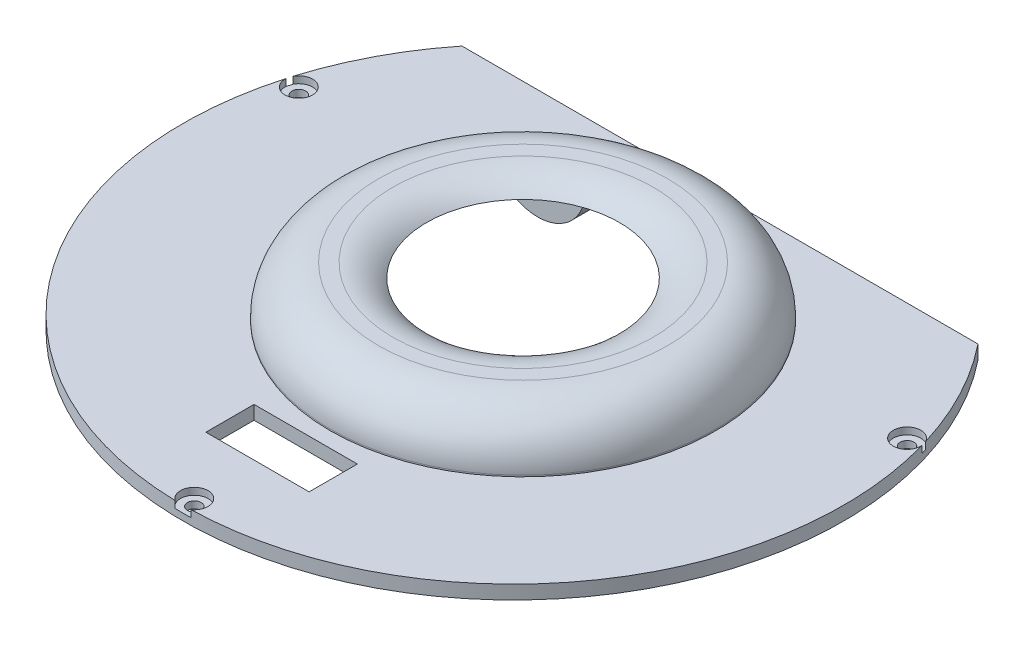
from build123d import *
from build123d.topology import SkipClean

# Parameters (mm, degrees)
BOSS_EXTRUDE1_DEPTH = 2
SKETCH4_R           = 1
CUT_EXTRUDE3_DEPTH  = 2
SKETCH5_R           = 2
CUT_EXTRUDE4_DEPTH  = 1
SKETCH2_R           = 5
CUT_EXTRUDE1_DEPTH  = 10
SKETCH3_R           = 24
CUT_EXTRUDE2_DEPTH  = 10
BOSS_EXTRUDE2_START = 7.2
SKETCH6_R           = 28
SKETCH6_R_2         = 24
BOSS_EXTRUDE2_DEPTH = 7.2
SKETCH7_R           = 28
SKETCH7_R_2         = 14
BOSS_EXTRUDE3_DEPTH = 2
SKETCH9_W           = 14
SKETCH9_H           = 12
BOSS_EXTRUDE4_DEPTH = 4
FILLET1_R           = 7
SKETCH10_R          = 3.25
CUT_EXTRUDE6_DEPTH  = 3
BOSS_EXTRUDE5_DEPTH = 2
FILLET2_R           = 7
FILLET3_R           = 7
FILLET4_R           = 4
FILLET5_R           = 4
SKETCH12_W          = 15
SKETCH12_H          = 7
CUT_EXTRUDE7_DEPTH  = 10


# Some blends are built 0.0001 mm under size
with BuildPart() as part:
    # Sketch1 → Boss-Extrude1 (new body)
    with BuildSketch(Plane(origin=(0, 0, 0), x_dir=(1, 0, 0), z_dir=(0, 1, 0))):
        with BuildLine():
            Line((-37.46998799, 30), (37.46998799, 30))
            ThreePointArc((37.46998799, 30), (0, -48), (-37.46998799, 30))
        make_face()
    extrude(amount=BOSS_EXTRUDE1_DEPTH)

    # Sketch4 → Cut-Extrude3 (cut)
    with BuildSketch(Plane(origin=(0, 2, 0), x_dir=(1, 0, 0), z_dir=(0, 1, 0))):
        with Locations(Location((-44.167045026, 13, 0), (0, 0, 270))):
            Circle(SKETCH4_R)
        with Locations(Location((0, -46.347801012, 0), (0, 0, 270))):
            Circle(SKETCH4_R)
        with Locations(Location((44.167045026, 13, 0), (0, 0, 270))):
            Circle(SKETCH4_R)
    extrude(amount=-CUT_EXTRUDE3_DEPTH, mode=Mode.SUBTRACT)

    # Sketch5 → Cut-Extrude4 (cut)
    with BuildSketch(Plane(origin=(0, 2, 0), x_dir=(1, 0, 0), z_dir=(0, 1, 0))):
        with Locations((-44.167045026, 13)):
            Circle(SKETCH5_R)
        with Locations((0, -46.347801012)):
            Circle(SKETCH5_R)
        with Locations((44.167045026, 13)):
            Circle(SKETCH5_R)
    extrude(amount=-CUT_EXTRUDE4_DEPTH, mode=Mode.SUBTRACT)

    # Sketch2 → Cut-Extrude1 (cut)
    with BuildSketch(Plane(origin=(0, 2, 0), x_dir=(1, 0, 0), z_dir=(0, 1, 0))):
        with Locations(Location((1.35, 0.05, 0), (0, 0, 270))):
            Circle(SKETCH2_R)
    extrude(amount=-CUT_EXTRUDE1_DEPTH, mode=Mode.SUBTRACT)

    # Sketch3 → Cut-Extrude2 (cut)
    with BuildSketch(Plane(origin=(0, 2, 0), x_dir=(1, 0, 0), z_dir=(0, 1, 0))):
        with Locations(Location((1.35, 0.05, 0), (0, 0, 270))):
            Circle(SKETCH3_R)
    extrude(amount=-CUT_EXTRUDE2_DEPTH, mode=Mode.SUBTRACT)

    # Sketch6 → Boss-Extrude2 (add)
    with BuildSketch(Plane(origin=(0, 2, 0), x_dir=(1, 0, 0), z_dir=(0, 1, 0)).offset(BOSS_EXTRUDE2_START)):
        with Locations(Location((1.35, 0.05, 0), (0, 0, 270))):
            Circle(SKETCH6_R)
        with Locations(Location((1.35, 0.05, 0), (0, 0, 270))):
            Circle(SKETCH6_R_2, mode=Mode.SUBTRACT)
    extrude(amount=-BOSS_EXTRUDE2_DEPTH)

    # Sketch7 → Boss-Extrude3 (add)
    with BuildSketch(Plane(origin=(0, 9.2, 0), x_dir=(1, 0, 0), z_dir=(0, 1, 0))):
        with Locations(Location((1.35, 0.05, 0), (0, 0, 270))):
            Circle(SKETCH7_R)
        with Locations(Location((1.35, 0.05, 0), (0, 0, 270))):
            Circle(SKETCH7_R_2, mode=Mode.SUBTRACT)
    extrude(amount=-BOSS_EXTRUDE3_DEPTH)

    # Sketch9 → Boss-Extrude4 (add)
    with BuildSketch(Plane(origin=(0, 0, -30), x_dir=(-1, 0, 0), z_dir=(0, 0, -1))):
        with Locations((-22.46998799, -4)):
            Rectangle(SKETCH9_W, SKETCH9_H)
        with Locations((22.46998799, -4)):
            Rectangle(SKETCH9_W, SKETCH9_H)
    extrude(amount=-BOSS_EXTRUDE4_DEPTH)

    # Fillet1
    fillet1_edges = [part.edges().sort_by_distance(p)[0] for p in [
        (-29.46998799, -10, -28),
        (-15.46998799, -10, -28),
        (15.46998799, -10, -28),
        (29.46998799, -10, -28),
    ]]
    fillet(fillet1_edges, radius=FILLET1_R - 0.0001)  # a hair under: the kernel refuses the full size

    # Sketch10 → Cut-Extrude6 (cut)
    with BuildSketch(Plane(origin=(0, 0, -30), x_dir=(-1, 0, 0), z_dir=(0, 0, -1))):
        with Locations((-22.46998799, -3)):
            Circle(SKETCH10_R)
        with Locations((22.46998799, -3)):
            Circle(SKETCH10_R)
    extrude(amount=-CUT_EXTRUDE6_DEPTH, mode=Mode.SUBTRACT)

    # Sketch11 → Boss-Extrude5 (add)
    with BuildSketch(Plane(origin=(0, 9.2, 0), x_dir=(1, 0, 0), z_dir=(0, 1, 0))):
        with BuildLine():
            Line((-8.65, 15.016629547), (-8.65, 9.847958971))
            ThreePointArc((-8.65, 9.847958971), (1.35, 14.05), (11.35, 9.847958971))
            Line((11.35, 9.847958971), (11.35, 15.016629547))
            ThreePointArc((11.35, 15.016629547), (1.35, 18.05), (-8.65, 15.016629547))
        make_face()
    extrude(amount=-BOSS_EXTRUDE5_DEPTH)

    # Fillet2
    fillet2_edges = [part.edges().sort_by_distance(p)[0] for p in [
        (1.35, 9.2, -28.05),
    ]]
    fillet(fillet2_edges, radius=FILLET2_R)

    # Fillet3
    # the kernel refuses this fillet: 7 mm, written as the material it takes off along each edge
    with BuildSketch(Plane(origin=(1.35, 9.2, -0.05), x_dir=(0, 0, 1), z_dir=(-1, 0, 0))) as fillet3_piece_1:
        with BuildLine():
            CenterArc((18.898979486, -7), FILLET3_R, 90, 44.415308597)
            Line((14, -2), (13.90202041, -1.9))
            ThreePointArc((13.90202041, -1.9), (13.86, -1), (13.86, 0))
            Line((13.86, 0), (14, 0.14))
            Line((14, 0.14), (18.898979486, 0.14))
            Line((18.898979486, 0.14), (18.898979486, 0))
        make_face()
    revolve(axis=Axis((1.35, 9.2, -0.05), (0, 1, 0)), revolution_arc=134.415308597, mode=Mode.SUBTRACT)
    with BuildSketch(Plane(origin=(1.35, 9.2, -0.05), x_dir=(-0.7142857142857139, 0, -0.6998542122237655), z_dir=(0.6998542122237655, 0, -0.7142857142857139))) as fillet3_piece_2:
        with BuildLine():
            CenterArc((18.898979486, -7), FILLET3_R, 90, 44.415308597)
            Line((14, -2), (13.90202041, -1.9))
            ThreePointArc((13.90202041, -1.9), (13.86, -1), (13.86, 0))
            Line((13.86, 0), (14, 0.14))
            Line((14, 0.14), (18.898979486, 0.14))
            Line((18.898979486, 0.14), (18.898979486, 0))
        make_face()
    revolve(axis=Axis((1.35, 9.2, -0.05), (0, 1, 0)), revolution_arc=134.415308597, mode=Mode.SUBTRACT)
    with BuildSketch(Plane(origin=(1.35, 9.2, -0.05), x_dir=(-0.7142857142857144, 0, -0.6998542122237652), z_dir=(-0.6998542122237652, 0, 0.7142857142857144))) as fillet3_piece_3:
        with BuildLine():
            CenterArc((18.898979486, 7), FILLET3_R, 225.584691403, 44.415308597)
            Line((14, 2), (13.90202041, 1.9))
            ThreePointArc((13.90202041, 1.9), (13.86, 1), (13.86, 0))
            Line((13.86, 0), (14, -0.14))
            Line((14, -0.14), (18.898979486, -0.14))
            Line((18.898979486, -0.14), (18.898979486, 0))
        make_face()
    revolve(axis=Axis((1.35, 9.2, -0.05), (0, -1, 0)), revolution_arc=91.169382806, mode=Mode.SUBTRACT)

    # Fillet4
    fillet4_edges = [part.edges().sort_by_distance(p)[0] for p in [
        (1.35, 7.2, -24.05),
    ]]
    fillet(fillet4_edges, radius=FILLET4_R)

    # Fillet5
    fillet5_edges = [part.edges().sort_by_distance(p)[0] for p in [
        (1.35, 0, -24.05),
    ]]
    fillet(fillet5_edges, radius=FILLET5_R)

    # Sketch12 → Cut-Extrude7 (cut)
    with SkipClean():  # the faces are left unmerged after this step: merging them gives an invalid solid
        with BuildSketch(Plane(origin=(0, 2, 0), x_dir=(1, 0, 0), z_dir=(0, 1, 0))):
            with Locations((0, -33.666351983)):
                Rectangle(SKETCH12_W, SKETCH12_H)
        extrude(amount=-CUT_EXTRUDE7_DEPTH, mode=Mode.SUBTRACT)


solid = part.part
